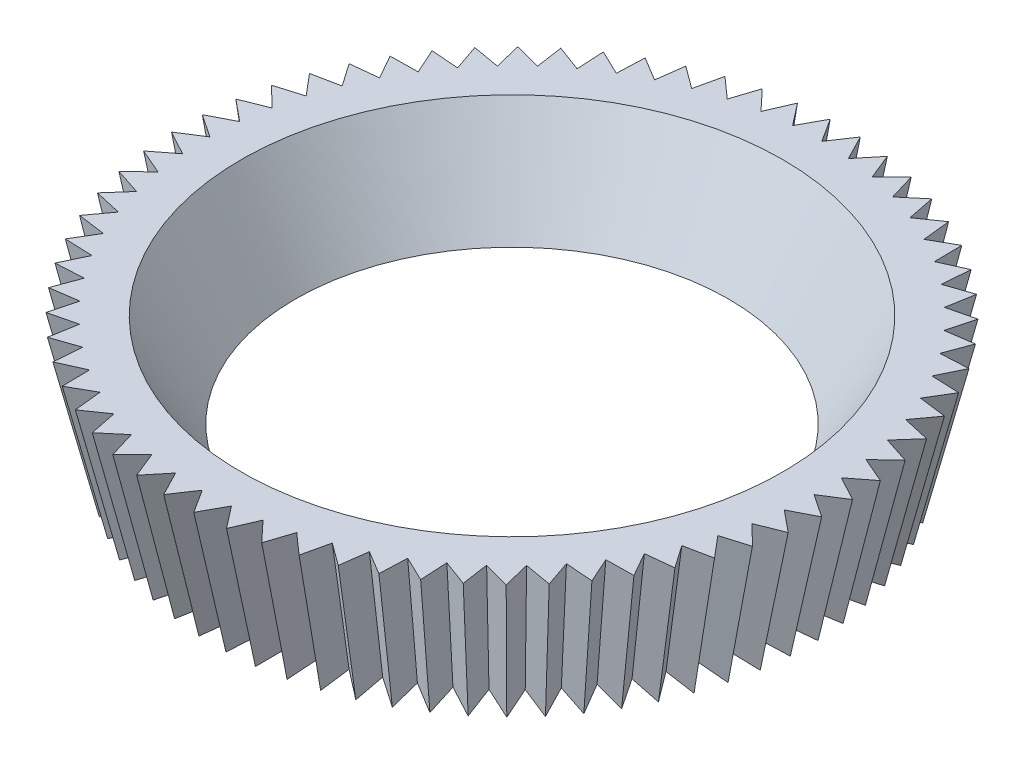
from build123d import *

# Parameters (mm, degrees)
CUT_EXTRUDE1_DEPTH = 11.316870365
CUT_EXTRUDE1_TAPER = -7
CIRPATTERN1_COUNT  = 68


with BuildPart() as part:
    # Sketch1 → Revolve1 (revolve)
    with BuildSketch(Plane.XY):
        Polygon((6.188943203, 12.09520842), (7, 13.5), (7, 15), (5.5, 15), (4.400268068, 13.09520842), align=None)
    revolve(axis=Axis((0, 12.09520842, 0), (0, 1, 0)))

    # Sketch2 → Cut-Extrude1 (cut, through all)
    with BuildSketch(Plane(origin=(0, 15, 0), x_dir=(1, 0, 0), z_dir=(0, 1, 0))):
        with BuildLine():
            ThreePointArc((0.057474451, -6.999764045), (0.55891124, -6.97765134), (1.057474451, -6.919663849))
            Line((1.057474451, -6.919663849), (0.496423012, -6.197525561))
            Line((0.496423012, -6.197525561), (0.057474451, -6.999764045))
        make_face()
    cut_extrude1 = extrude(amount=-CUT_EXTRUDE1_DEPTH, taper=CUT_EXTRUDE1_TAPER, mode=Mode.SUBTRACT)

    # CirPattern1: Cut-Extrude1 ×68 about axis
    cirpattern1_axis = Axis((0, 15, 0), (0, -1, 0))
    for i in range(1, CIRPATTERN1_COUNT):
        add(cut_extrude1.rotate(cirpattern1_axis, i * 360 / CIRPATTERN1_COUNT), mode=Mode.SUBTRACT)


solid = part.part
